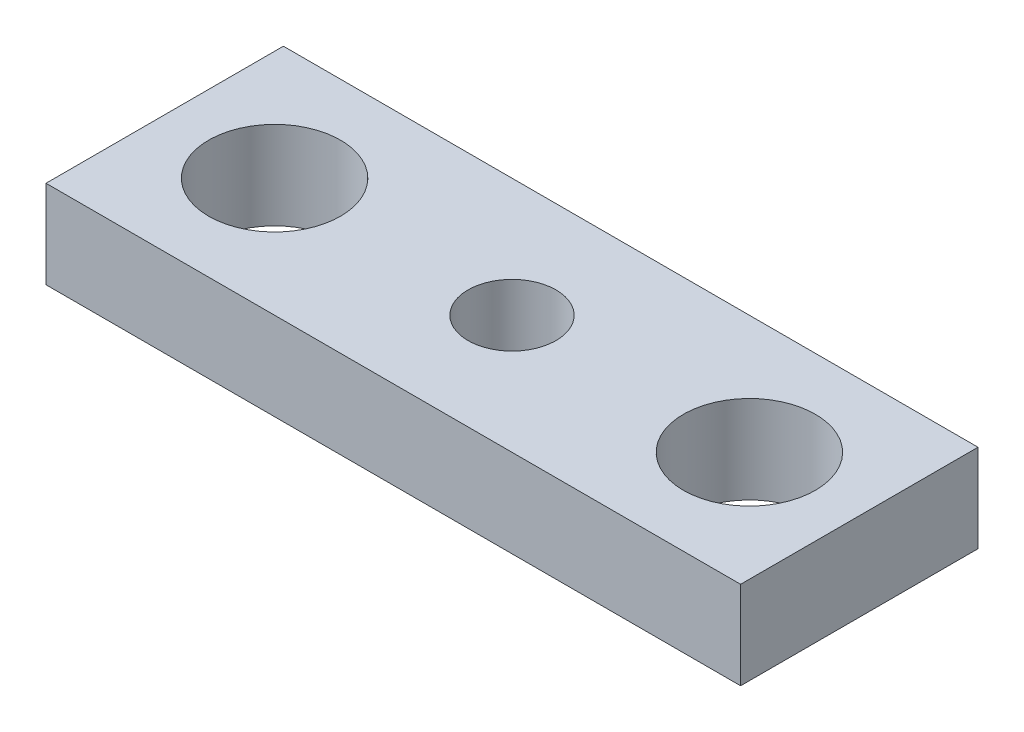
from build123d import *

# Parameters (mm, degrees)
SKETCH_1_W          = 79
SKETCH_1_H          = 27
EXTRUDE_1_DEPTH     = 10
SKETCH_3_R          = 7.5
CUT_EXTRUDE_1_DEPTH = 43.924352063
SKETCH_10_R         = 5
CUT_EXTRUDE_2_DEPTH = 43.924352063


with BuildPart() as part:
    # 草图1 → 凸台-拉伸1 (new body)
    with BuildSketch(Plane(origin=(0, 0, 0), x_dir=(1, 0, 0), z_dir=(0, 1, 0))):
        Rectangle(SKETCH_1_W, SKETCH_1_H)
    extrude(amount=EXTRUDE_1_DEPTH)

    # 草图3 → 切除-拉伸1 (cut, through all)
    with BuildSketch(Plane(origin=(0, 10, 0), x_dir=(1, 0, 0), z_dir=(0, 1, 0))):
        with Locations((-27, 0)):
            Circle(SKETCH_3_R)
        with Locations((27, 0)):
            Circle(SKETCH_3_R)
    extrude(amount=-CUT_EXTRUDE_1_DEPTH, mode=Mode.SUBTRACT)

    # 草图10 → 切除-拉伸2 (cut, through all)
    with BuildSketch(Plane.XZ):
        Circle(SKETCH_10_R)
    extrude(amount=-CUT_EXTRUDE_2_DEPTH, mode=Mode.SUBTRACT)


solid = part.part
